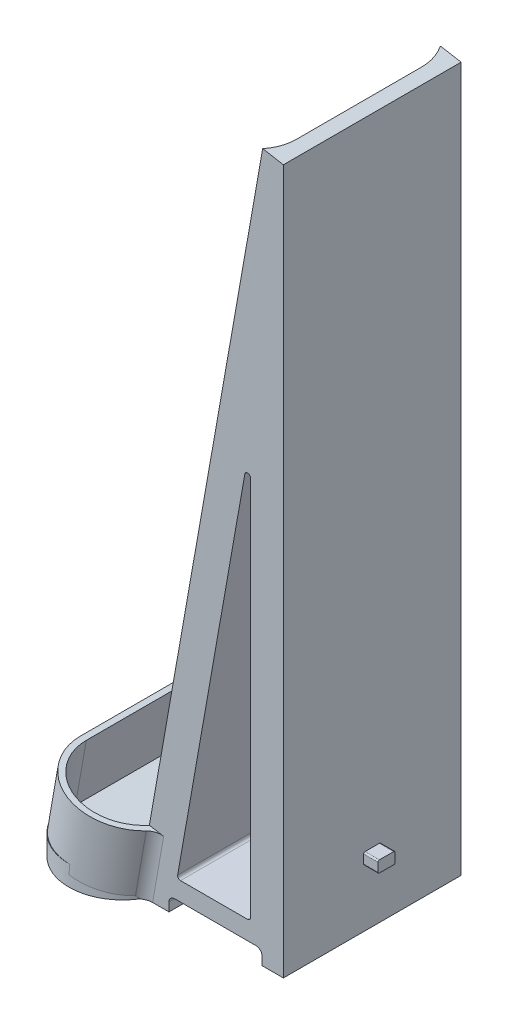
from build123d import *

# Parameters (mm, degrees)
BOSS_EXTRUDE1_DEPTH   = 3.175
BOSS_EXTRUDE2_START   = -3.175
BOSS_EXTRUDE2_DEPTH   = 11.112499999999999
BODY_MOVE_COPY2_ANGLE = 90.0000000000002
BOSS_EXTRUDE5_START   = -3.175
BOSS_EXTRUDE5_DEPTH   = 127
BOSS_EXTRUDE7_DEPTH   = 3.622257574
CUT_EXTRUDE1_START    = -11.112499999999999
CUT_EXTRUDE1_DEPTH    = 11.112499999999999
CUT_EXTRUDE4_REACH    = 131.332
LOFT1_START           = -15.77975
LOFT1_DEPTH           = 31.5595
CUT_EXTRUDE5_DEPTH    = 1.27
CUT_EXTRUDE6_DEPTH    = 133.79321580314624
FILLET2_R             = 0.508
CUT_EXTRUDE7_DEPTH    = 133.79321580314624
FILLET3_R             = 2.54
BOSS_EXTRUDE8_DEPTH   = 2.54


with BuildPart() as part:
    # Sketch4 → Boss-Extrude1 (new body)
    with BuildSketch(Plane(origin=(0, 0, 0), x_dir=(0.984807753012208, -0.17364817766693072, 0), z_dir=(0.17364817766693072, 0.984807753012208, 0))):
        with BuildLine():
            Line((0, -8.731249999999998), (-22.225, -8.731249999999998))
            ThreePointArc((-22.225, -8.731249999999998), (-30.956249999999997, -1.63e-15), (-22.225000000000005, 8.73124999999999))
            Line((-22.225000000000005, 8.73124999999999), (1.71e-15, 8.73125))
            ThreePointArc((1.71e-15, 8.73125), (8.731249999999998, 0), (0, -8.731249999999998))
        make_face()
    extrude(amount=BOSS_EXTRUDE1_DEPTH)

    # Sketch5 → Boss-Extrude2 (add)
    with BuildSketch(Plane(origin=(0.5513329640925053, 3.1267646158137623, 0), x_dir=(0.9848077530122081, -0.17364817766693072, 0), z_dir=(0.17364817766693072, 0.9848077530122081, 0)).offset(BOSS_EXTRUDE2_START)):
        with BuildLine():
            Line((1.57e-15, 9.74725), (-22.225000000000005, 9.74724999999999))
            ThreePointArc((-22.225000000000005, 9.74724999999999), (-31.97225, -1.51e-15), (-22.225, -9.747249999999998))
            Line((-22.225, -9.747249999999998), (1.79e-15, -9.74725))
            ThreePointArc((1.79e-15, -9.74725), (9.74725, 2.16e-15), (1.57e-15, 9.74725))
        make_face()
        with BuildLine():
            Line((5.3e-16, 8.73125), (-22.225000000000005, 8.73124999999999))
            ThreePointArc((-22.225000000000005, 8.73124999999999), (-30.956249999999997, -1.63e-15), (-22.225000000000005, -8.731249999999998))
            Line((-22.225000000000005, -8.731249999999998), (-1.6e-15, -8.73125))
            ThreePointArc((-1.6e-15, -8.73125), (8.73125, -1.94e-15), (5.3e-16, 8.73125))
        make_face(mode=Mode.SUBTRACT)
    extrude(amount=BOSS_EXTRUDE2_DEPTH)


with BuildPart() as part_1:
    # Body-Move/Copy2: moved
    add(part.part.moved(Location((5e-17, 2.8e-16, 0))).rotate(Axis((-10.943676155348163, 1.9296653743237675, 1.73e-15), (0.1736481776669307, 0.984807753012208, 0)), BODY_MOVE_COPY2_ANGLE))

    # Sketch6 → Boss-Extrude5 (add)
    with BuildSketch(Plane(origin=(0.5513329640925054, 3.1267646158137636, -9e-17), x_dir=(0.9848077530122081, -0.1736481776669307, 0), z_dir=(0.1736481776669307, 0.9848077530122081, 0)).offset(BOSS_EXTRUDE5_START)):
        with BuildLine():
            Line((4.4e-16, 15.779750000000002), (-2.5553006918151486, 15.779750000000002))
            ThreePointArc((-2.5553006918151517, 15.77975), (-1.6674472336253352, 13.520790016359634), (-1.3652500000000423, 11.112500000000036))
            Line((-1.3652500000000418, 11.112500000000034), (-1.3652499999999672, -11.11250000000001))
            ThreePointArc((-1.3652499999999694, -11.112500000000013), (-1.667447233625257, -13.520790016359623), (-2.5553006918150736, -15.77975))
            Line((-2.555300691815072, -15.779750000000002), (4.49e-15, -15.779750000000002))
            Line((-1.1e-16, -15.77975), (-1.1e-16, 15.779750000000002))
        make_face()
        with BuildLine():
            ThreePointArc((-1.3652500000000423, 11.112500000000036), (-1.6674472336253352, 13.520790016359634), (-2.5553006918151517, 15.77975))
            Line((-2.5553006918151486, 15.779750000000002), (-3.733373764462396, 15.779750000000002))
            ThreePointArc((-3.7333737644623968, 15.77975), (-2.7260906817477455, 13.54208130327656), (-2.381250000000044, 11.11250000000003))
            Line((-2.3812500000000436, 11.112500000000027), (-2.381249999999966, -11.112499999999974))
            ThreePointArc((-2.3812499999999677, -11.112499999999974), (-2.7260906817476602, -13.542081303276534), (-3.7333737644623177, -15.779750000000003))
            Line((-3.7333737644623204, -15.779750000000002), (-2.555300691815072, -15.779750000000002))
            ThreePointArc((-2.5553006918150736, -15.77975), (-1.667447233625257, -13.520790016359623), (-1.3652499999999694, -11.112500000000013))
            Line((-1.3652499999999672, -11.11250000000001), (-1.3652500000000418, 11.112500000000034))
        make_face()
    extrude(amount=BOSS_EXTRUDE5_DEPTH)


with BuildPart() as boss_extrude7_tool:
    # Boss-Extrude7: read off the stored shape, not the designer's step
    # Boss-Extrude7 outline → Boss-Extrude7 (new body)
    with BuildSketch(Plane(origin=(0, 0, 0), x_dir=(1, 0, 0), z_dir=(0, 1, 0))):
        with BuildLine():
            Line((22.053318564, 15.77975), (-2.516479933, 15.77975))
            add(Edge.make_bspline(
                [(-2.516479933, 15.77975), (-6.087914144025663, 22.428833371813603), (-13.315378834961066, 20.557552766374705), (-20.54284352589647, 18.686272160935808), (-20.542843526, 11.1125)],
                knots=[2.070114834496927, 2.070114834496927, 2.070114834496927, 3.3912519074408096, 3.3912519074408096, 4.712388980384692, 4.712388980384692, 4.712388980384692], degree=2, weights=[1, 0.7896435245481747, 1, 0.7896435245481747, 1]))
            Line((-20.542843526, 11.1125), (-20.542843526, -11.1125))
            add(Edge.make_bspline(
                [(-20.542843526, -11.1125), (-20.542843525896345, -18.68627216093585), (-13.315378834960956, -20.557552766374716), (-6.08791414402557, -22.428833371813585), (-2.516479933, -15.77975)],
                knots=[4.712388980384692, 4.712388980384692, 4.712388980384692, 6.033526053328573, 6.033526053328573, 7.354663126272453, 7.354663126272453, 7.354663126272453], degree=2, weights=[1, 0.7896435245481753, 1, 0.7896435245481753, 1]))
            Line((-2.516479933, -15.77975), (22.053318564, -15.77975))
            Line((22.053318564, -15.77975), (22.053318564, 15.77975))
        make_face()
    extrude(amount=BOSS_EXTRUDE7_DEPTH)


with BuildPart() as part_2:
    add(part_1.part)


with BuildPart() as part_3:
    # Boss-Extrude7: joined with boss_extrude7_tool
    add(part_2.part.fuse(boss_extrude7_tool.part, tol=0.00001))

    # Sketch8 → Cut-Extrude1 (cut)
    with BuildSketch(Plane(origin=(1.929665374323769, 10.943676155348173, 0), x_dir=(0.9848077530122081, -0.17364817766693075, 0), z_dir=(0.17364817766693075, 0.9848077530122081, 0)).offset(CUT_EXTRUDE1_START)):
        with BuildLine():
            ThreePointArc((-3.7333737644623213, -15.779750000000003), (-3.2397646593705955, -14.88804828056871), (-2.853430222713813, -13.944900567790237))
            Line((-2.8534302227138113, -13.944900567790235), (-2.853430222713809, 13.94490056779))
            ThreePointArc((-2.8534302227138095, 13.94490056779), (-3.2397646593706177, 14.888048280568597), (-3.7333737644623985, 15.779750000000003))
            ThreePointArc((-3.7333737644623985, 15.779750000000003), (-13.542081303276605, 19.498909318252295), (-19.843750000000043, 11.112499999999972))
            Line((-19.843750000000046, 11.112499999999972), (-19.843749999999957, -11.112500000000043))
            ThreePointArc((-19.843749999999957, -11.112500000000042), (-13.54208130327649, -19.498909318252302), (-3.7333737644623213, -15.779750000000003))
        make_face()
    extrude(amount=CUT_EXTRUDE1_DEPTH, mode=Mode.SUBTRACT)

    # Sketch9 → Cut-Extrude4 (cut, up to next)
    with BuildSketch(Plane(origin=(0, 0, 0), x_dir=(0.9848077530122081, -0.17364817766693072, 0), z_dir=(0.17364817766693072, 0.9848077530122081, 0)), mode=Mode.PRIVATE) as cut_extrude4_sk1:
        with BuildLine():
            Line((-2.3812500000174737, -11.112499999999976), (-2.3812500000295542, 11.112500000000031))
            ThreePointArc((-2.3812500000295542, 11.112500000000031), (-2.500104004853256, 12.54824433126907), (-2.853430222713811, 13.944900567789999))
            Line((-2.853430222713811, 13.944900567789999), (-2.8534302227138113, -13.944900567790238))
            ThreePointArc((-2.8534302227138113, -13.944900567790238), (-2.500104004825662, -12.548244331273757), (-2.3812500000174737, -11.112499999999976))
        make_face()
    cut_extrude4_tool1 = extrude(cut_extrude4_sk1.sketch, amount=CUT_EXTRUDE4_REACH, mode=Mode.PRIVATE) & part_3.part
    add(cut_extrude4_tool1.solids().sort_by_distance((-2.584299, 0.455682, 0))[0], mode=Mode.SUBTRACT)

    # Loft1: read off the stored shape, not the designer's step
    # Loft1 outline → Loft1 (add)
    with BuildSketch(Plane.XY.offset(LOFT1_START)):
        Polygon((0.638701741, 3.622257574), (22.053318564, 3.622257574), (22.053318564, 125.070584633), align=None)
    extrude(amount=LOFT1_DEPTH)

    # Sketch12 → Cut-Extrude5 (cut)
    with BuildSketch(Plane(origin=(-2.345073461860326, 0.4134997230693797, 8.13e-15), x_dir=(3.36e-15, -5.9e-16, 1), z_dir=(-0.9848077530122081, 0.17364817766693072, 3.4134285390241548e-15))):
        with BuildLine():
            Line((-5.228221385273689, 114.22616766869933), (-0.12014507933680221, 114.22616766869933))
            add(Edge.make_bspline(
                [(-0.12014507933680221, 114.22616766869933), (0.07011968746962734, 114.22366909294938), (0.4411432164598798, 114.21879677524308), (0.9827741836600262, 114.17779062534875), (1.494126462329712, 114.10940638067792), (1.976272538251337, 114.0201107238905), (2.4258159831780612, 113.8958508526396), (2.846789640496429, 113.75076106159327), (3.2364123180406654, 113.57537489061744), (3.476580661151348, 113.43401615220935), (3.59407848992688, 113.36485905753871)],
                knots=[0, 0, 0, 0, 1.182376437119959, 2.305679005411862, 3.373202861573748, 4.38770938204811, 5.350376953479489, 6.268953384896463, 7.153118116444824, 8, 8, 8, 8], degree=3))
            add(Edge.make_bspline(
                [(3.59407848992688, 113.36485905753871), (3.7378787021642528, 113.26859900310113), (4.018252781224821, 113.08091621951313), (4.388442547868716, 112.74844804018409), (4.701416531623982, 112.38382962893776), (4.959695904779897, 111.98831066442631), (5.156117661939543, 111.55891716025648), (5.297432419351558, 111.1005637999526), (5.387891930540603, 110.61058984670753), (5.3965078564153615, 110.27234488132945), (5.400924630058811, 110.09895069597692)],
                knots=[0, 0, 0, 0, 1.0604796362436606, 2.067667333365926, 3.040862740220127, 4.0009023693274575, 4.955444635567215, 5.9271800263127785, 6.937412326837788, 8, 8, 8, 8], degree=3))
            add(Edge.make_bspline(
                [(5.400924630058811, 110.09895069597692), (5.397493058523768, 109.94376899276502), (5.3907923093439525, 109.64074932381718), (5.316867296627098, 109.20084612163079), (5.204149909546891, 108.78836521305224), (5.045292694282028, 108.40215934170175), (4.8378643415488884, 108.04538379924806), (4.583775694978403, 107.71622832331954), (4.287937265399445, 107.41091639148242), (4.058499321138568, 107.23855837370101), (3.9418624086289658, 107.15093857260379)],
                knots=[0, 0, 0, 0, 1.0854956756165175, 2.1196219236003433, 3.1134599711837283, 4.0743661896149845, 5.034707347550299, 5.993519082000086, 6.979986767058713, 8, 8, 8, 8], degree=3))
            add(Edge.make_bspline(
                [(3.9418624086289658, 107.15093857260379), (3.8674061020696757, 107.10088467302324), (3.7115153425793963, 106.99608575427958), (3.4527062359864646, 106.85561854380855), (3.1610901044496735, 106.72655205210827), (2.8385879725396244, 106.60485385068067), (2.486635569748659, 106.48730233965028), (2.1011619316461143, 106.38357058470808), (1.6861022595943742, 106.28087750946315), (1.3962794538586694, 106.22573847793748), (1.246537038687801, 106.19724985803789)],
                knots=[0, 0, 0, 0, 0.7474757140938376, 1.5650058692857316, 2.4502682500189836, 3.403591130996996, 4.437214553887347, 5.541548615613701, 6.729794755303424, 8, 8, 8, 8], degree=3))
            Line((1.246537038687801, 106.19724985803789), (1.246537038687801, 106.13475743514613))
            add(Edge.make_bspline(
                [(1.246537038687801, 106.13475743514613), (1.3660718402415537, 106.09071887952346), (1.6042519967499904, 106.00296945480137), (1.9468078176663832, 105.83231695525419), (2.272230351154713, 105.62779767822659), (2.5841780822657423, 105.39252783143037), (2.8810909309636, 105.12492533590407), (3.163673559657734, 104.82445574826548), (3.4344208083879644, 104.49333631807275), (3.596003402073053, 104.2523268186339), (3.6783074077375413, 104.12956577887941)],
                knots=[0, 0, 0, 0, 0.9509700540078693, 1.894864034191553, 2.852141104007893, 3.818150398457251, 4.809710567344614, 5.833759715287508, 6.896599883703487, 8, 8, 8, 8], degree=3))
            add(Edge.make_bspline(
                [(3.6783074077375413, 104.12956577887941), (3.775692600347029, 103.97408233985871), (3.979602254489536, 103.64852387017702), (4.2885028949926935, 103.13363510666991), (4.612027836066335, 102.56837441845246), (4.953795517003646, 101.9567395283279), (5.308731303043535, 101.29540349015345), (5.682472577026052, 100.58790380717947), (6.0694581075513865, 99.83080584339513), (6.331407875788347, 99.30876421533503), (6.466012881083948, 99.04050890599655)],
                knots=[0, 0, 0, 0, 0.7584941997821967, 1.5881704990499537, 2.482219144382332, 3.451093378059206, 4.484786460106584, 5.585221915356614, 6.759146766730135, 8, 8, 8, 8], degree=3))
            Line((6.466012881083948, 99.04050890599655), (4.346704626493113, 99.04050890599655))
            add(Edge.make_bspline(
                [(4.346704626493113, 99.04050890599655), (4.277356486192602, 99.20008226398323), (4.141116467962076, 99.51357700381334), (3.933941220184338, 99.97207322371179), (3.733535252246594, 100.41163643016142), (3.5386164470888235, 100.83086630514678), (3.34464723776627, 101.22755296425665), (3.1571473476643748, 101.60521553155496), (2.9764923498675473, 101.96418752150187), (2.7965282612002222, 102.3003469576902), (2.6228873824530443, 102.61713813313123), (2.4510721009562677, 102.91245986763002), (2.2873337607202027, 103.1890726898358), (2.124915748817319, 103.44382624931505), (1.9689717279499828, 103.6790023444885), (1.8167463558670436, 103.89373327881812), (1.670093961641272, 104.08855646111223), (1.5694830719355621, 104.20787414422202), (1.5209602870386663, 104.26541887212241)],
                knots=[0, 0, 0, 0, 1.4018530954257313, 2.7540535398598456, 4.053703774180958, 5.29423820197095, 6.478936837861934, 7.611353305162164, 8.691569836876138, 9.716620789310689, 10.683390878219486, 11.60209260650502, 12.46936221612508, 13.273055428587995, 14.03606427660493, 14.742693929439772, 15.393624366211194, 16, 16, 16, 16], degree=3))
            add(Edge.make_bspline(
                [(1.5209602870386663, 104.26541887212241), (1.4190542612158992, 104.37546577264021), (1.2174884622533795, 104.59313387663241), (0.8788604577850404, 104.87690606734962), (0.5137419428527865, 105.11421238931482), (0.1269062745209998, 105.31257173612752), (-0.28672510091762743, 105.46039470190755), (-0.722246339159558, 105.57045903530886), (-1.1832155194799538, 105.63649932804356), (-1.4992911336278083, 105.64437900547513), (-1.6607191567124484, 105.64840336133616)],
                knots=[0, 0, 0, 0, 1.0037135747502297, 1.9853029003006932, 2.9492317428411914, 3.914876407151171, 4.889583371749836, 5.883999607408954, 6.91930365731249, 8, 8, 8, 8], degree=3))
            Line((-1.6607191567124484, 105.64840336133616), (-3.5028871010875595, 105.64840336133616))
            Line((-3.5028871010875595, 105.64840336133616), (-3.5028871010875595, 99.04050890599655))
            Line((-3.5028871010875595, 99.04050890599655), (-5.228221385273689, 99.04050890599655))
            Line((-5.228221385273689, 99.04050890599655), (-5.228221385273689, 114.22616766869933))
        make_face()
        with BuildLine():
            Line((-3.5028871010875595, 112.77797369472893), (-3.5028871010875595, 107.04225609800937))
            Line((-3.5028871010875595, 107.04225609800937), (-0.7233328133357322, 107.04225609800937))
            add(Edge.make_bspline(
                [(-0.7233328133357322, 107.04225609800937), (-0.5656930761106643, 107.04431166122919), (-0.2582121559467261, 107.04832109743738), (0.1901043869444131, 107.0803068638523), (0.6119547944730254, 107.13734212129056), (1.0077513279490957, 107.21581100143905), (1.3784536567911683, 107.31591436722339), (1.7237653533404567, 107.43796621032233), (2.045583124079988, 107.58043717802614), (2.2420715093154806, 107.69865087593946), (2.338795908361539, 107.75684336846757)],
                knots=[0, 0, 0, 0, 1.1875963187305736, 2.316441370015899, 3.383740988879004, 4.3927372118522054, 5.354458331418604, 6.273829826032473, 7.1502664519934145, 8, 8, 8, 8], degree=3))
            add(Edge.make_bspline(
                [(2.338795908361539, 107.75684336846757), (2.4350413205497894, 107.82121345081156), (2.6230503163003602, 107.94695611493154), (2.8657662061494764, 108.17726563658894), (3.075236791541213, 108.42605034915319), (3.2486179112064186, 108.69920310543876), (3.378976840180573, 108.99852086119226), (3.4708248720680217, 109.32021673071652), (3.529833366333951, 109.66478330055456), (3.536374232403317, 109.90307243222955), (3.5397372526296795, 110.0255900256257)],
                knots=[0, 0, 0, 0, 1.0314879885760737, 2.014943013404641, 2.973070494454056, 3.9281942196848556, 4.890674066012517, 5.875290488997613, 6.907569581020537, 8, 8, 8, 8], degree=3))
            add(Edge.make_bspline(
                [(3.5397372526296795, 110.0255900256257), (3.536682182278085, 110.13717578609096), (3.5307676732467637, 110.3532019040146), (3.482949585730688, 110.66638265938118), (3.408721186406818, 110.9590567307924), (3.2986345508693007, 111.22972569904219), (3.159748412095904, 111.48014636365708), (2.986701905772532, 111.70696933816976), (2.78287508097514, 111.91178647481205), (2.551360345619989, 112.09893033374662), (2.2835855889430103, 112.25815799339519), (1.9885120908976983, 112.39976229175929), (1.6608122335584756, 112.51536914134584), (1.304538609403633, 112.61457480390641), (0.9157867847630289, 112.68450592338743), (0.4979422856846321, 112.73983224521153), (0.04881998571170654, 112.77217056247194), (-0.2613809106226743, 112.77599609144411), (-0.42173894633626763, 112.77797369472893)],
                knots=[0, 0, 0, 0, 0.9766163042266848, 1.8906949060826796, 2.7678355815559565, 3.6146226865584, 4.441911446639659, 5.268287420021439, 6.103859296954358, 6.967123262252878, 7.867510274299778, 8.825268696679245, 9.828724916005934, 10.906140664176334, 12.06024543163793, 13.283940868520185, 14.5959360132326, 16, 16, 16, 16], degree=3))
            Line((-0.42173894633626763, 112.77797369472893), (-3.5028871010875595, 112.77797369472893))
        make_face(mode=Mode.SUBTRACT)
    extrude(amount=-CUT_EXTRUDE5_DEPTH, mode=Mode.SUBTRACT)

    # Sketch13 → Cut-Extrude6 (cut, through all)
    with BuildSketch(Plane(origin=(-8e-17, -4.3e-16, -15.779750000000002), x_dir=(-1, 0, 0), z_dir=(0, -3e-17, -1))):
        Polygon((-5.020709493215531, 16.330763945263843), (-3.171257415384888, 5.842), (-4.367504164096216, 5.842), (-16.211318563640102, 5.842), (-16.211318563640102, 79.79586171686451), align=None)
    extrude(amount=-CUT_EXTRUDE6_DEPTH, mode=Mode.SUBTRACT)

    # Fillet2
    fillet2_edges = [part_3.edges().sort_by_distance(p)[0] for p in [
        (3.171257415384888, 5.842, -1.78e-15),
        (16.211318563640102, 5.842, -1.78e-15),
        (16.211318563640102, 79.79586171686451, -1.78e-15),
    ]]
    fillet(fillet2_edges, radius=FILLET2_R)

    # Sketch15 → Cut-Extrude7 (cut, through all)
    with BuildSketch(Plane.XY.offset(15.779750000000002)):
        with BuildLine():
            Line((18.243318563640102, -4.3e-16), (1.733318563640101, -2.45e-15))
            Line((1.733318563640101, -2.45e-15), (1.733318563640101, 1.5239999999999905))
            ThreePointArc((1.733318563640101, 1.5239999999999905), (2.0308980739545683, 2.24242048968553), (2.7493185636401076, 2.5399999999999974))
            Line((2.7493185636401076, 2.5399999999999974), (17.227318563640093, 2.5399999999999996))
            ThreePointArc((17.227318563640093, 2.5399999999999996), (17.945739053325635, 2.242420489685533), (18.243318563640102, 1.5239999999999927))
            Line((18.243318563640102, 1.5239999999999927), (18.243318563640102, -4.3e-16))
        make_face()
    extrude(amount=-CUT_EXTRUDE7_DEPTH, mode=Mode.SUBTRACT)

    # Fillet3
    fillet3_edges = [part_3.edges().sort_by_distance(p)[0] for p in [
        (-1.5516472454151984, 5.915561386198842, -15.779750000000057),
        (-1.5516472454151131, 5.915561386198828, 15.779750000000059),
    ]]
    fillet(fillet3_edges, radius=FILLET3_R)

    # Sketch14 → Boss-Extrude8 (add)
    with BuildSketch(Plane(origin=(22.0533185636401, 0, 0), x_dir=(0, 0, -1), z_dir=(1, 0, 0))):
        with BuildLine():
            Line((-1.270000000000001, 12.192000000000002), (1.2699999999999956, 12.192000000000002))
            ThreePointArc((1.2699999999999956, 12.192000000000002), (1.4496051224213813, 12.117605122421384), (1.5239999999999971, 11.937999999999999))
            Line((1.5239999999999971, 11.937999999999999), (1.5239999999999978, 10.414000000000003))
            ThreePointArc((1.5239999999999978, 10.414000000000003), (1.449605122421382, 10.234394877578618), (1.2699999999999962, 10.16))
            Line((1.2699999999999962, 10.16), (-1.2700000000000002, 10.16))
            ThreePointArc((-1.2700000000000002, 10.16), (-1.4496051224213853, 10.234394877578618), (-1.5240000000000022, 10.414000000000003))
            Line((-1.5240000000000022, 10.414000000000003), (-1.5240000000000027, 11.937999999999999))
            ThreePointArc((-1.5240000000000027, 11.937999999999999), (-1.4496051224213866, 12.117605122421384), (-1.270000000000001, 12.192000000000002))
        make_face()
    extrude(amount=BOSS_EXTRUDE8_DEPTH)


solid = part_3.part
